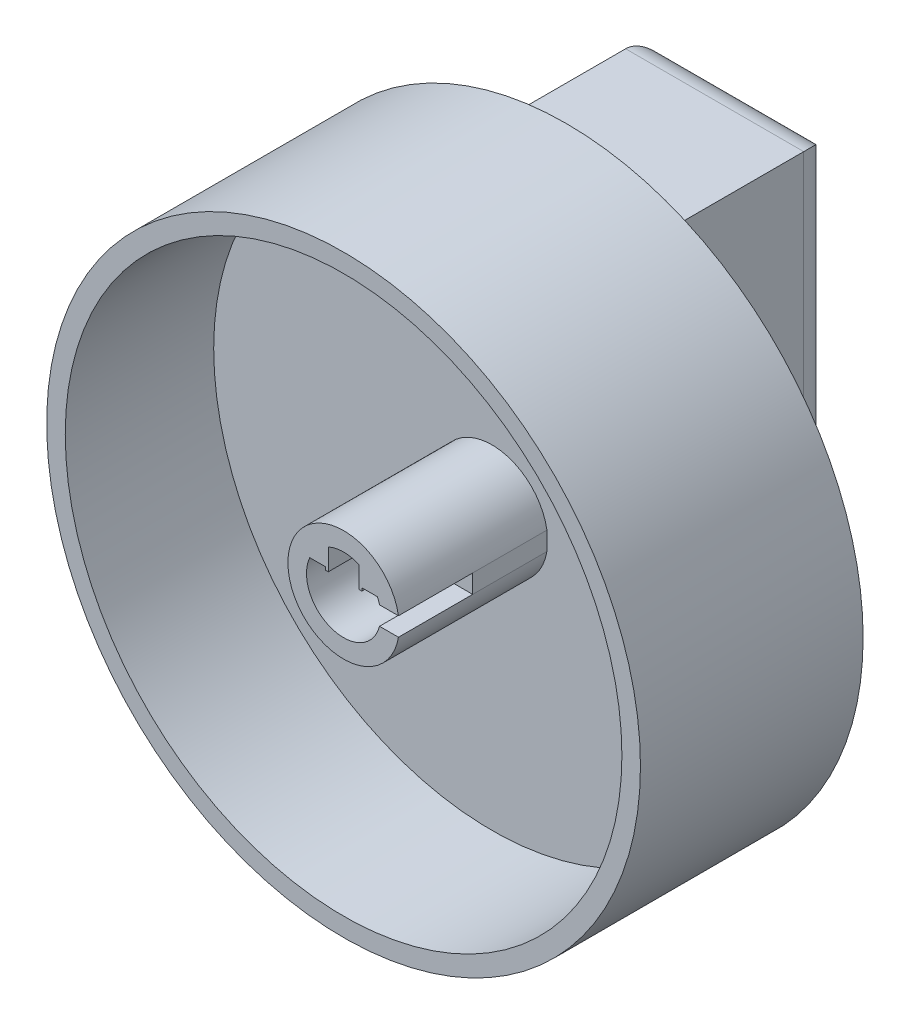
from build123d import *

# Parameters (mm, degrees)
BOSS_EXTRUDE1_DEPTH = 31.75
SKETCH4_R           = 25.4
SKETCH4_R_2         = 23.8125
BOSS_EXTRUDE3_DEPTH = 12.7
SKETCH5_W           = 1.621707797
SKETCH5_H           = 1.5875
BOSS_EXTRUDE4_DEPTH = 25.4
SKETCH6_W           = 0.254
SKETCH6_H           = 0.254
BOSS_EXTRUDE5_DEPTH = 31.75
SKETCH9_R           = 25.4
SKETCH9_R_2         = 4.593847271
BOSS_EXTRUDE6_DEPTH = 6.35
SKETCH10_W          = 15.24
SKETCH10_H          = 41.544062962
SKETCH10_W_2        = 10.16
SKETCH10_H_2        = 36.95031579
BOSS_EXTRUDE7_DEPTH = 12.7
SKETCH11_W          = 15.24
SKETCH11_H          = 41.544062962
BOSS_EXTRUDE8_DEPTH = 2.54
FILLET1_R           = 2.54
FILLET2_R           = 2.54
CUT_EXTRUDE1_DEPTH  = 2.54


with BuildPart() as part:
    # Sketch2 → Boss-Extrude1 (new body)
    with BuildSketch(Plane.XY):
        with BuildLine():
            ThreePointArc((3.074180531, 0.79375), (-3.175, 0), (3.074180531, -0.79375))
            Line((3.074180531, -0.79375), (4.695888328, -0.79375))
            ThreePointArc((4.695888328, -0.79375), (-4.7625, 0), (4.695888328, 0.79375))
            Line((4.695888328, 0.79375), (3.074180531, 0.79375))
        make_face()
    extrude(amount=BOSS_EXTRUDE1_DEPTH)

    # Sketch5 → Boss-Extrude4 (add)
    with BuildSketch(Plane.XY):
        with Locations((3.88503443, 0)):
            Rectangle(SKETCH5_W, SKETCH5_H)
    extrude(amount=BOSS_EXTRUDE4_DEPTH)

    # Sketch6 → Boss-Extrude5 (add)
    with BuildSketch(Plane.XY):
        with BuildLine():
            Line((-1.306315103, 2.893815103), (-1.306315103, 1.306315103))
            Line((-1.306315103, 1.306315103), (-1.306315103, 1.052315103))
            Line((-1.306315103, 1.052315103), (-1.560315103, 1.052315103))
            Line((-1.560315103, 1.052315103), (-1.560315103, 1.306315103))
            Line((-1.560315103, 1.306315103), (-2.893815103, 1.306315103))
            ThreePointArc((-2.893815103, 1.306315103), (-2.428847118, 2.428847118), (-1.306315103, 2.893815103))
        make_face()
        with BuildLine():
            Line((1.306315103, 1.306315103), (2.893815103, 1.306315103))
            ThreePointArc((2.893815103, 1.306315103), (2.428847118, 2.428847118), (1.306315103, 2.893815103))
            Line((1.306315103, 2.893815103), (1.306315103, 1.306315103))
        make_face()
        with Locations((1.433315103, 1.179315103)):
            Rectangle(SKETCH6_W, SKETCH6_H)
    extrude(amount=BOSS_EXTRUDE5_DEPTH)



with BuildPart() as body_2:
    # Sketch4 → Boss-Extrude3 (new body)
    with BuildSketch(Plane.XY.offset(31.75)):
        Circle(SKETCH4_R)
        Circle(SKETCH4_R_2, mode=Mode.SUBTRACT)
    extrude(amount=-BOSS_EXTRUDE3_DEPTH)


with BuildPart() as part_1:
    add(part.part)

    add(body_2.part)  # Boss-Extrude6 merges body 2
    # Sketch9 → Boss-Extrude6 (add)
    with BuildSketch(Plane(origin=(0, 0, 19.05), x_dir=(-1, 0, 0), z_dir=(0, 0, -1))):
        with Locations(Location((0, 0, 0), (0, 0, 180))):
            Circle(SKETCH9_R)
        Circle(SKETCH9_R_2, mode=Mode.SUBTRACT)
    extrude(amount=BOSS_EXTRUDE6_DEPTH)

    # Sketch10 → Boss-Extrude7 (add)
    with BuildSketch(Plane(origin=(0, 0, 12.7), x_dir=(-1, 0, 0), z_dir=(0, 0, -1))):
        Rectangle(SKETCH10_W, SKETCH10_H)
        Rectangle(SKETCH10_W_2, SKETCH10_H_2, mode=Mode.SUBTRACT)
    extrude(amount=BOSS_EXTRUDE7_DEPTH)

    # Sketch11 → Boss-Extrude8 (add)
    with BuildSketch(Plane(origin=(0, 0, 0), x_dir=(-1, 0, 0), z_dir=(0, 0, -1))):
        Rectangle(SKETCH11_W, SKETCH11_H)
    extrude(amount=BOSS_EXTRUDE8_DEPTH)

    # Fillet1
    # the kernel refuses this fillet: 2.54 mm, written as the material it adds along each edge
    with BuildSketch(Plane(origin=(-7.62, -20.772031481, 12.7), x_dir=(-1, 0, 0), z_dir=(0, 1, 0)), Plane(origin=(7.62, 20.772031481, 12.7), x_dir=(1, 0, 0), z_dir=(0, -1, 0))) as fillet1_piece_1:
        with BuildLine():
            CenterArc((FILLET1_R, -FILLET1_R), FILLET1_R, 90, 90)
            Line((0, -FILLET1_R), (0, 0))
            Line((0, 0), (FILLET1_R, 0))
        make_face()
    extrude(amount=41.544062961)
    with BuildSketch(Plane(origin=(-7.62, 20.772031481, 12.7), x_dir=(0, 1, 0), z_dir=(1, 0, 0)), Plane(origin=(7.62, -20.772031481, 12.7), x_dir=(0, -1, 0), z_dir=(-1, 0, 0))) as fillet1_piece_2:
        with BuildLine():
            CenterArc((FILLET1_R, -FILLET1_R), FILLET1_R, 90, 90)
            Line((0, -FILLET1_R), (0, 0))
            Line((0, 0), (FILLET1_R, 0))
        make_face()
    extrude(amount=15.24)
    with BuildSketch(Plane(origin=(7.62, -20.772031481, 12.7), x_dir=(0, -1, 0), z_dir=(-1, 0, 0))) as fillet1_piece_3a_section:
        with BuildLine():
            CenterArc((FILLET1_R, -FILLET1_R), FILLET1_R, 90, 90)
            Line((0, -FILLET1_R), (0, 0))
            Line((0, 0), (FILLET1_R, 0))
        make_face()
    fillet1_piece_3a = extrude(amount=21.59, mode=Mode.PRIVATE)
    fillet1_piece_3a = fillet1_piece_3a & Plane(origin=(0, 0, 12.091015905), x_dir=(1, 0, 0), z_dir=(0, 0, 1)) * Cylinder(25.4, 54, mode=Mode.PRIVATE)
    fillet1_piece_3a = split(fillet1_piece_3a, bisect_by=Plane(origin=(-7.62, -21.280779279, 12.091015905), z_dir=(-1, 0, 0)), keep=Keep.TOP, mode=Mode.PRIVATE)
    with BuildSketch(Plane(origin=(-7.62, -27.122031481, 12.7), x_dir=(-1, 0, 0), z_dir=(0, 1, 0))) as fillet1_piece_3b_section:
        with BuildLine():
            CenterArc((FILLET1_R, -FILLET1_R), FILLET1_R, 90, 90)
            Line((0, -FILLET1_R), (0, 0))
            Line((0, 0), (FILLET1_R, 0))
        make_face()
    fillet1_piece_3b = extrude(amount=47.894062961, mode=Mode.PRIVATE)
    fillet1_piece_3b = fillet1_piece_3b & Plane(origin=(0, 0, 12.105999198), x_dir=(1, 0, 0), z_dir=(0, 0, 1)) * Cylinder(25.4, 106, mode=Mode.PRIVATE)
    fillet1_piece_3b = split(fillet1_piece_3b, bisect_by=Plane(origin=(-8.162359675, -20.772031481, 12.105999198), z_dir=(0, -1, 0)), keep=Keep.TOP, mode=Mode.PRIVATE)
    fillet1_piece_3 = fillet1_piece_3a & fillet1_piece_3b
    add(fillet1_piece_3)
    with BuildSketch(Plane(origin=(-7.62, -20.772031481, 12.7), x_dir=(-1, 0, 0), z_dir=(0, 1, 0))) as fillet1_piece_4a_section:
        with BuildLine():
            CenterArc((FILLET1_R, -FILLET1_R), FILLET1_R, 90, 90)
            Line((0, -FILLET1_R), (0, 0))
            Line((0, 0), (FILLET1_R, 0))
        make_face()
    fillet1_piece_4a = extrude(amount=47.894062961, mode=Mode.PRIVATE)
    fillet1_piece_4a = fillet1_piece_4a & Plane(origin=(0, 0, 12.105997934), x_dir=(1, 0, 0), z_dir=(0, 0, 1)) * Cylinder(25.4, 106, mode=Mode.PRIVATE)
    fillet1_piece_4a = split(fillet1_piece_4a, bisect_by=Plane(origin=(-8.162364443, 20.772031481, 12.105997934), z_dir=(0, 1, 0)), keep=Keep.TOP, mode=Mode.PRIVATE)
    with BuildSketch(Plane(origin=(-13.97, 20.772031481, 12.7), x_dir=(0, 1, 0), z_dir=(1, 0, 0))) as fillet1_piece_4b_section:
        with BuildLine():
            CenterArc((FILLET1_R, -FILLET1_R), FILLET1_R, 90, 90)
            Line((0, -FILLET1_R), (0, 0))
            Line((0, 0), (FILLET1_R, 0))
        make_face()
    fillet1_piece_4b = extrude(amount=21.59, mode=Mode.PRIVATE)
    fillet1_piece_4b = fillet1_piece_4b & Plane(origin=(0, 0, 12.0910159), x_dir=(1, 0, 0), z_dir=(0, 0, 1)) * Cylinder(25.4, 54, mode=Mode.PRIVATE)
    fillet1_piece_4b = split(fillet1_piece_4b, bisect_by=Plane(origin=(-7.62, 21.28077831, 12.0910159), z_dir=(-1, 0, 0)), keep=Keep.TOP, mode=Mode.PRIVATE)
    fillet1_piece_4 = fillet1_piece_4a & fillet1_piece_4b
    add(fillet1_piece_4)
    with BuildSketch(Plane(origin=(-7.62, 20.772031481, 12.7), x_dir=(0, 1, 0), z_dir=(1, 0, 0))) as fillet1_piece_5a_section:
        with BuildLine():
            CenterArc((FILLET1_R, -FILLET1_R), FILLET1_R, 90, 90)
            Line((0, -FILLET1_R), (0, 0))
            Line((0, 0), (FILLET1_R, 0))
        make_face()
    fillet1_piece_5a = extrude(amount=21.59, mode=Mode.PRIVATE)
    fillet1_piece_5a = fillet1_piece_5a & Plane(origin=(0, 0, 12.091015905), x_dir=(1, 0, 0), z_dir=(0, 0, 1)) * Cylinder(25.4, 54, mode=Mode.PRIVATE)
    fillet1_piece_5a = split(fillet1_piece_5a, bisect_by=Plane(origin=(7.62, 21.280779279, 12.091015905), z_dir=(1, 0, 0)), keep=Keep.TOP, mode=Mode.PRIVATE)
    with BuildSketch(Plane(origin=(7.62, 27.122031481, 12.7), x_dir=(1, 0, 0), z_dir=(0, -1, 0))) as fillet1_piece_5b_section:
        with BuildLine():
            CenterArc((FILLET1_R, -FILLET1_R), FILLET1_R, 90, 90)
            Line((0, -FILLET1_R), (0, 0))
            Line((0, 0), (FILLET1_R, 0))
        make_face()
    fillet1_piece_5b = extrude(amount=47.894062961, mode=Mode.PRIVATE)
    fillet1_piece_5b = fillet1_piece_5b & Plane(origin=(0, 0, 12.105999198), x_dir=(1, 0, 0), z_dir=(0, 0, 1)) * Cylinder(25.4, 106, mode=Mode.PRIVATE)
    fillet1_piece_5b = split(fillet1_piece_5b, bisect_by=Plane(origin=(8.162359675, 20.772031481, 12.105999198), z_dir=(0, 1, 0)), keep=Keep.TOP, mode=Mode.PRIVATE)
    fillet1_piece_5 = fillet1_piece_5a & fillet1_piece_5b
    add(fillet1_piece_5)
    with BuildSketch(Plane(origin=(13.97, -20.772031481, 12.7), x_dir=(0, -1, 0), z_dir=(-1, 0, 0))) as fillet1_piece_6a_section:
        with BuildLine():
            CenterArc((FILLET1_R, -FILLET1_R), FILLET1_R, 90, 90)
            Line((0, -FILLET1_R), (0, 0))
            Line((0, 0), (FILLET1_R, 0))
        make_face()
    fillet1_piece_6a = extrude(amount=21.59, mode=Mode.PRIVATE)
    fillet1_piece_6a = fillet1_piece_6a & Plane(origin=(0, 0, 12.0910159), x_dir=(1, 0, 0), z_dir=(0, 0, 1)) * Cylinder(25.4, 54, mode=Mode.PRIVATE)
    fillet1_piece_6a = split(fillet1_piece_6a, bisect_by=Plane(origin=(7.62, -21.28077831, 12.0910159), z_dir=(1, 0, 0)), keep=Keep.TOP, mode=Mode.PRIVATE)
    with BuildSketch(Plane(origin=(7.62, 20.772031481, 12.7), x_dir=(1, 0, 0), z_dir=(0, -1, 0))) as fillet1_piece_6b_section:
        with BuildLine():
            CenterArc((FILLET1_R, -FILLET1_R), FILLET1_R, 90, 90)
            Line((0, -FILLET1_R), (0, 0))
            Line((0, 0), (FILLET1_R, 0))
        make_face()
    fillet1_piece_6b = extrude(amount=47.894062961, mode=Mode.PRIVATE)
    fillet1_piece_6b = fillet1_piece_6b & Plane(origin=(0, 0, 12.105997934), x_dir=(1, 0, 0), z_dir=(0, 0, 1)) * Cylinder(25.4, 106, mode=Mode.PRIVATE)
    fillet1_piece_6b = split(fillet1_piece_6b, bisect_by=Plane(origin=(8.162364443, -20.772031481, 12.105997934), z_dir=(0, -1, 0)), keep=Keep.TOP, mode=Mode.PRIVATE)
    fillet1_piece_6 = fillet1_piece_6a & fillet1_piece_6b
    add(fillet1_piece_6)

    # Fillet2
    fillet2_edges = [part_1.edges().sort_by_distance(p)[0] for p in [
        (-7.62, 0, -2.54),
        (0, 20.772031481, -2.54),
        (7.62, 0, -2.54),
        (0, -20.772031481, -2.54),
    ]]
    fillet(fillet2_edges, radius=FILLET2_R)

    # Sketch12 → Cut-Extrude1 (cut)
    with BuildSketch(Plane(origin=(0, 0, 12.7), x_dir=(-1, 0, 0), z_dir=(0, 0, -1))):
        with BuildLine():
            Line((16.813868884, 14.704492606), (17.547564981, 16.722156872))
            Line((17.547564981, 16.722156872), (18.489141639, 14.704492606))
            add(Edge.make_bspline(
                [(18.489141639, 14.704492606), (19.798776644, 12.786117496), (18.310846307, 9.647278033), (13.185757244, 9.226397866), (12.693603367, 13.337843102), (13.512236449, 14.704492606)],
                knots=[0, 0, 0, 0, 0.432949875, 0.596956743, 1, 1, 1, 1], degree=3))
            Line((13.512236449, 14.704492606), (14.00136718, 16.691586201))
            Line((14.00136718, 16.691586201), (14.612780594, 14.704492606))
            Line((14.612780594, 14.704492606), (15.591042056, 18.678679797))
            Line((15.591042056, 18.678679797), (16.813868884, 14.704492606))
        make_face()
        Polygon((22.65270588, 5.371871988), (23.452991012, 5.371871988), (23.452991012, -1.999175277), (22.65270588, -1.999175277), (22.65270588, 1.033484169), (20.757293726, 1.033484169), (20.757293726, -1.999175277), (19.662166704, -1.999175277), (19.662166704, 5.371871988), (20.757293726, 5.371871988), (20.757293726, 2.549813892), (22.65270588, 2.549813892), align=None)
        Polygon((-23.636155952, 5.371871988), (-23.636155952, -1.999175277), (-19.528236773, -1.999175277), (-19.528236773, -0.945591056), (-22.125891548, -0.945591056), (-22.125891548, 5.371871988), align=None)
    extrude(amount=-CUT_EXTRUDE1_DEPTH, mode=Mode.SUBTRACT)


solid = part_1.part
